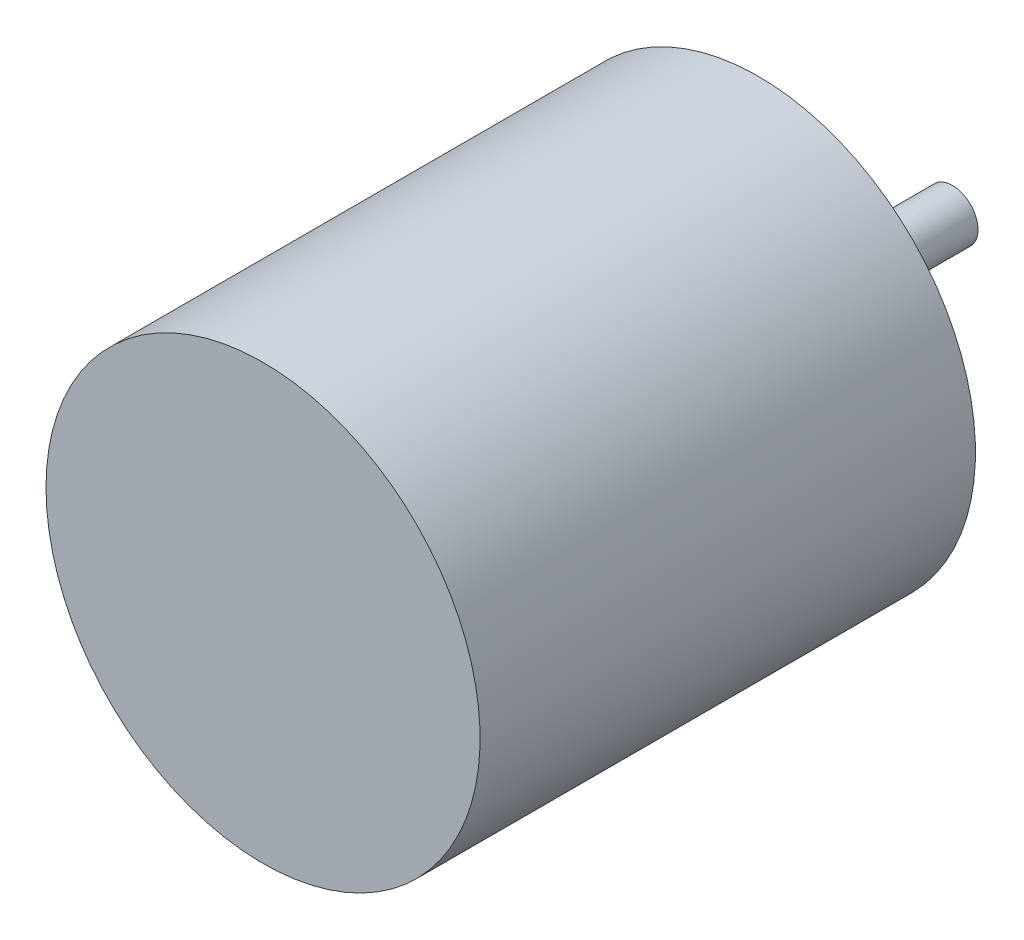
from build123d import *

# Parameters (mm, degrees)
ESBO_O1_R                = 21.25
RESSALTO_EXTRUS_O1_DEPTH = 24.25
ESBO_O2_R                = 2.5
RESSALTO_EXTRUS_O2_DEPTH = 19
ESBO_O3_R                = 1.5
CORTE_EXTRUS_O1_DEPTH    = 2


with BuildPart() as part:
    # Esboço1 → Ressalto-extrusão1 (new, symmetric)
    with BuildSketch(Plane.XY):
        Circle(ESBO_O1_R)
    extrude(amount=RESSALTO_EXTRUS_O1_DEPTH, both=True)

    # Esboço2 → Ressalto-extrusão2 (add)
    with BuildSketch(Plane(origin=(0, 0, -24.25), x_dir=(-1, 0, 0), z_dir=(0, 0, -1))):
        Circle(ESBO_O2_R)
    extrude(amount=RESSALTO_EXTRUS_O2_DEPTH)

    # Esboço3 → Corte-extrusão1 (cut)
    with BuildSketch(Plane(origin=(0, 0, -24.25), x_dir=(-1, 0, 0), z_dir=(0, 0, -1))):
        with Locations((-8.672819651, 9.001788672)):
            Circle(ESBO_O3_R)
        with Locations((9.001788672, 8.672819651)):
            Circle(ESBO_O3_R)
        with Locations((8.672819651, -9.001788672)):
            Circle(ESBO_O3_R)
        with Locations((-9.001788672, -8.672819651)):
            Circle(ESBO_O3_R)
    extrude(amount=-CORTE_EXTRUS_O1_DEPTH, mode=Mode.SUBTRACT)


solid = part.part
